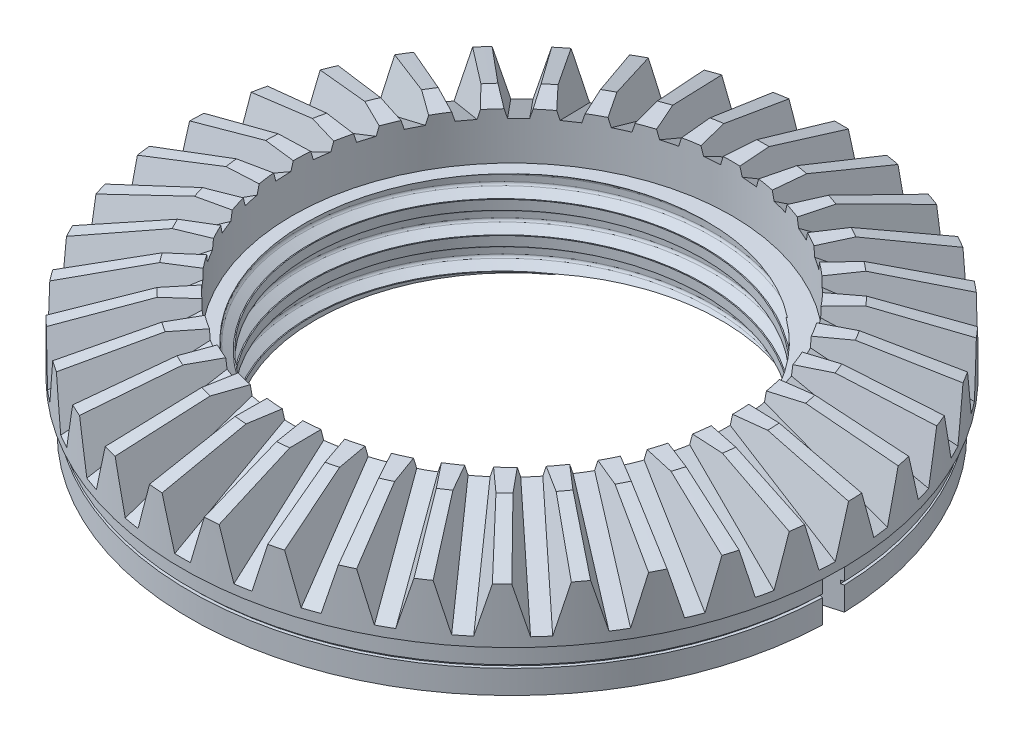
from build123d import *

# Parameters (mm, degrees)
SKETCH1_R           = 21
SKETCH1_R_2         = 14
BOSS_EXTRUDE1_DEPTH = 8
CUT_EXTRUDE1_DEPTH  = 17
CIRPATTERN1_COUNT   = 37
SKETCH5_R           = 23.402255284
SKETCH5_R_2         = 20.5
CUT_EXTRUDE2_DEPTH  = 3
CUT_EXTRUDE3_DEPTH  = 3
CUT_EXTRUDE4_START  = -1.5
SKETCH12_R          = 20.5
SKETCH12_R_2        = 20.3
CUT_EXTRUDE4_DEPTH  = 0.2
SKETCH13_R          = 14
SKETCH13_R_2        = 12.5
BOSS_EXTRUDE2_DEPTH = 5
CUT_SWEEP1_PITCH    = 2


with BuildPart() as part:
    # Sketch1 → Boss-Extrude1 (new body)
    with BuildSketch(Plane(origin=(0, 0, 0), x_dir=(1, 0, 0), z_dir=(0, 1, 0))):
        with Locations(Location((0, 0, 0), (0, 0, 270))):
            Circle(SKETCH1_R)
        with Locations(Location((0, 0, 0), (0, 0, 270))):
            Circle(SKETCH1_R_2, mode=Mode.SUBTRACT)
    extrude(amount=BOSS_EXTRUDE1_DEPTH)

    # Sketch2 → Cut-Revolve1 (revolve, cut)
    with BuildSketch(Plane.XY, mode=Mode.PRIVATE) as cut_revolve1_sk:
        Polygon((16, 8), (21, 6.5), (21, 8), align=None)
    revolve(cut_revolve1_sk.sketch.rotate(Axis((0, 0, 0), (0, 1, 0)), 90), axis=Axis((0, 0, 0), (0, 1, 0)), mode=Mode.SUBTRACT)

    # Sketch4 → Cut-Extrude1 (cut)
    with BuildSketch(Plane(origin=(0, 0.746944858, 25.86067247), x_dir=(1, 0, 0), z_dir=(0, -0.48470519027895625, 0.8746775854660053))):
        Polygon((0, 3.127066368), (-1.5, 3.127066368), (-0.5, 0.127066368), (0.5, 0.127066368), (1.5, 3.127066368), align=None)
    cut_extrude1 = extrude(amount=-CUT_EXTRUDE1_DEPTH, mode=Mode.SUBTRACT)

    # CirPattern1: Cut-Extrude1 ×37 about axis
    cirpattern1_axis = Axis((0, 0, 0), (0, 1, 0))
    for i in range(1, CIRPATTERN1_COUNT):
        add(cut_extrude1.rotate(cirpattern1_axis, i * 360 / CIRPATTERN1_COUNT), mode=Mode.SUBTRACT)

    # Sketch5 → Cut-Extrude2 (cut)
    with BuildSketch(Plane.XZ):
        Circle(SKETCH5_R)
        with Locations(Location((0, 0, 0), (0, 0, 270))):
            Circle(SKETCH5_R_2, mode=Mode.SUBTRACT)
    extrude(amount=-CUT_EXTRUDE2_DEPTH, mode=Mode.SUBTRACT)

    # Sketch11 → Cut-Extrude3 (cut)
    with BuildSketch(Plane.XZ):
        with BuildLine():
            Line((-20.488045295, 0.7), (-18, 0))
            Line((-18, 0), (-20.488045295, -0.7))
            ThreePointArc((-20.488045295, -0.7), (-20.5, 0), (-20.488045295, 0.7))
        make_face()
        with BuildLine():
            Line((20.488045295, -0.7), (18, 0))
            Line((18, 0), (20.488045295, 0.7))
            ThreePointArc((20.488045295, 0.7), (20.5, 0), (20.488045295, -0.7))
        make_face()
    extrude(amount=-CUT_EXTRUDE3_DEPTH, mode=Mode.SUBTRACT)

    # Sketch12 → Cut-Extrude4 (cut)
    with BuildSketch(Plane.XZ.offset(CUT_EXTRUDE4_START)):
        Circle(SKETCH12_R)
        Circle(SKETCH12_R_2, mode=Mode.SUBTRACT)
    extrude(amount=-CUT_EXTRUDE4_DEPTH, mode=Mode.SUBTRACT)

    # Sketch13 → Boss-Extrude2 (add)
    with BuildSketch(Plane.XZ):
        with Locations(Location((0, 0, 0), (0, 0, 270))):
            Circle(SKETCH13_R)
        with Locations(Location((0, 0, 0), (0, 0, 270))):
            Circle(SKETCH13_R_2, mode=Mode.SUBTRACT)
    extrude(amount=-BOSS_EXTRUDE2_DEPTH)

    # Cut-Sweep1: arcs per turn and ends read off the stored shape
    # Cut-Sweep1: the profile of Sketch15 screwed along a right-hand helix through 4 turns, 10 arcs to a turn; built about Z, then put on its axis
    cut_sweep1_z = Axis((0, 0, 0), (0, 0, 1))
    cut_sweep1_corners = [(12.563416163, 0.017819577, -2.699773151), (12.343220381, 0.017819577, -2.699773151), (12.343220381, -0.017819577, -1.300226849), (12.563416163, -0.017819577, -1.300226849), (13.085098515, -0.009143935, -1.640918499), (13.175715631, -0.004881551, -1.808301942), (13.175715631, 0.004881551, -2.191698058), (13.085098515, 0.009143935, -2.359081501)]
    with BuildLine(mode=Mode.PRIVATE) as cut_sweep1_profile:
        Line(cut_sweep1_corners[0], cut_sweep1_corners[1])
        Line(cut_sweep1_corners[1], cut_sweep1_corners[2])
        Line(cut_sweep1_corners[2], cut_sweep1_corners[3])
        Line(cut_sweep1_corners[3], cut_sweep1_corners[4])
        Line(cut_sweep1_corners[5], cut_sweep1_corners[6])
        Line(cut_sweep1_corners[7], cut_sweep1_corners[0])
        ThreePointArc((13.085098515, -0.009143935, -1.640918499), (13.151608463, -0.007304836, -1.713139768), (13.175715631, -0.004881551, -1.808301942))
        ThreePointArc((13.175715631, 0.004881551, -2.191698058), (13.151608463, 0.007304836, -2.286860232), (13.085098515, 0.009143935, -2.359081501))
    cut_sweep1_cap = Face(cut_sweep1_profile.wire())
    cut_sweep1_arcs = [((13.085098515, -0.009143935, -1.640918499), (13.175715631, -0.007636962, -1.700097221), (13.175715631, -0.004881551, -1.808301942), (1, 0.8794641604293546, 1)), ((13.175715631, 0.004881551, -2.191698058), (13.175715631, 0.007636962, -2.299902779), (13.085098515, 0.009143935, -2.359081501), (1, 0.8794641604293557, 1))]  # start, shoulder, end, weights
    cut_sweep1_turn_angles = [0, 18, 36, 54, 72, 90, 108, 126, 144, 162, 180, 198, 216, 234, 252, 270, 288, 306, 324, 342, 360]
    cut_sweep1_turn_weights = [1, 0.9510565162951535, 1, 0.9510565162951535, 1, 0.9510565162951535, 1, 0.9510565162951535, 1, 0.9510565162951535, 1, 0.9510565162951535, 1, 0.9510565162951535, 1, 0.9510565162951535, 1, 0.9510565162951535, 1, 0.9510565162951535, 1]
    cut_sweep1_turn_rails = [Edge.make_bspline([Vector(p[0], p[1], 0).rotate(cut_sweep1_z, cut_sweep1_turn_angles[k]) / cut_sweep1_turn_weights[k] + Vector(0, 0, p[2] + CUT_SWEEP1_PITCH * cut_sweep1_turn_angles[k] / 360) for k in range(21)], [0, 0, 0, 1, 1, 2, 2, 3, 3, 4, 4, 5, 5, 6, 6, 7, 7, 8, 8, 9, 9, 10, 10, 10], 2, cut_sweep1_turn_weights) for p in cut_sweep1_corners]
    cut_sweep1_turn_sides = [*[Face.make_surface_from_curves(cut_sweep1_turn_rails[p[0]], cut_sweep1_turn_rails[p[1]]) for p in [(0, 1), (1, 2), (2, 3), (3, 4), (5, 6), (7, 0)]], *[Face.make_bezier_surface([[Vector(p[j][0], p[j][1], 0).rotate(cut_sweep1_z, cut_sweep1_turn_angles[2 * i + k]) / cut_sweep1_turn_weights[2 * i + k] + Vector(0, 0, p[j][2] + CUT_SWEEP1_PITCH * cut_sweep1_turn_angles[2 * i + k] / 360) for k in range(3)] for j in range(3)], [[p[3][j] * cut_sweep1_turn_weights[2 * i + k] for k in range(3)] for j in range(3)]) for p in cut_sweep1_arcs for i in range(10)]]
    cut_sweep1 = Plane(origin=(0, 0, 0), x_dir=(1, 0, 0), z_dir=(0, 1, 0)) * Solid(Shell([*[p.moved(Location((0, 0, CUT_SWEEP1_PITCH * i))) for i in range(4) for p in cut_sweep1_turn_sides], cut_sweep1_cap, cut_sweep1_cap.rotate(cut_sweep1_z, 1440).moved(Location((0, 0, CUT_SWEEP1_PITCH * 1440 / 360)))]))
    add(cut_sweep1, mode=Mode.SUBTRACT)


solid = part.part
